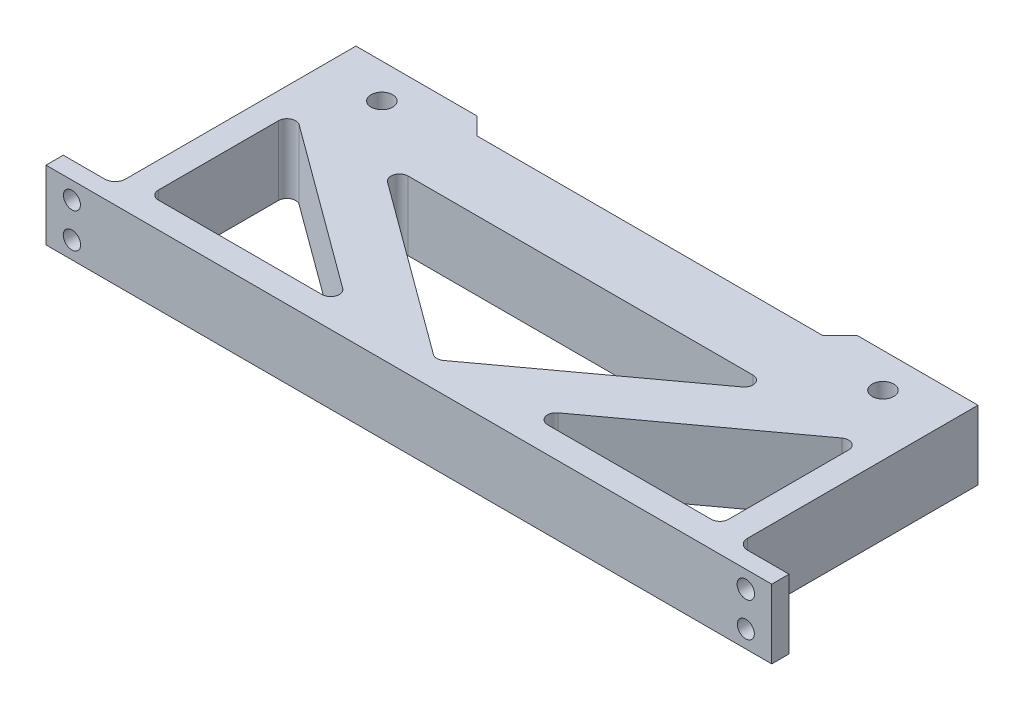
from build123d import *

# Parameters (mm, degrees)
SKETCH1_R           = 7.9375
BOSS_EXTRUDE1_DEPTH = 50.8
FILLET3_R           = 6.35
SKETCH2_W           = 82.55
SKETCH2_H           = 28.1432
CUT_EXTRUDE1_DEPTH  = 63.5
SKETCH3_W           = 38.1
SKETCH3_H           = 50.8
SKETCH3_R           = 6.235288689
SKETCH3_R_2         = 6.385077563
SKETCH3_R_3         = 6.411115974
SKETCH3_R_4         = 6.251946274
BOSS_EXTRUDE3_DEPTH = 12.7
FILLET4_R           = 7.62


with BuildPart() as part:
    # Sketch1 → Boss-Extrude1 (new body)
    with BuildSketch(Plane(origin=(0, 0, 0), x_dir=(1, 0, 0), z_dir=(0, 1, 0))):
        Polygon((-139.7, 94.8436), (-127, 82.1436), (127, 82.1436), (139.7, 94.8436), (228.6, 94.8436), (228.6, -94.8436), (-228.6, -94.8436), (-228.6, 94.8436), align=None)
        with Locations((-184.15, 69.4436)):
            Circle(SKETCH1_R, mode=Mode.SUBTRACT)
        with Locations((184.15, 69.4436)):
            Circle(SKETCH1_R, mode=Mode.SUBTRACT)
        Polygon((146.05, 31.3436), (-146.05, 31.3436), (0, -75.7936), align=None, mode=Mode.SUBTRACT)
        Polygon((-209.55, 31.3436), (-209.55, -75.7936), (-63.5, -75.7936), align=None, mode=Mode.SUBTRACT)
        Polygon((209.55, -75.7936), (63.5, -75.7936), (209.55, 31.3436), align=None, mode=Mode.SUBTRACT)
    extrude(amount=BOSS_EXTRUDE1_DEPTH)

    # Fillet3
    fillet3_edges = [part.edges().sort_by_distance(p)[0] for p in [
        (63.5, 25.4, 75.7936),
        (209.55, 25.4, -31.3436),
        (209.55, 25.4, 75.7936),
        (-63.5, 25.4, 75.7936),
        (-209.55, 25.4, -31.3436),
        (-209.55, 25.4, 75.7936),
        (146.05, 25.4, -31.3436),
        (0, 25.4, 75.7936),
        (-146.05, 25.4, -31.3436),
    ]]
    fillet(fillet3_edges, radius=FILLET3_R)

    # Sketch2 → Cut-Extrude1 (cut)
    with BuildSketch(Plane(origin=(0, 0, -94.8436), x_dir=(-1, 0, 0), z_dir=(0, 0, -1))):
        with Locations((184.15, 25.4)):
            Rectangle(SKETCH2_W, SKETCH2_H)
        with Locations((-184.15, 25.4)):
            Rectangle(SKETCH2_W, SKETCH2_H)
    extrude(amount=-CUT_EXTRUDE1_DEPTH, mode=Mode.SUBTRACT)

    # Sketch3 → Boss-Extrude3 (add)
    # profile 1 of 2: a face of its own
    with BuildSketch(Plane.XY.offset(94.8436)):
        with Locations((-247.65, 25.4)):
            Rectangle(SKETCH3_W, SKETCH3_H)
        with Locations((-247.65, 38.1)):
            Circle(SKETCH3_R, mode=Mode.SUBTRACT)
        with Locations((-247.65, 12.7)):
            Circle(SKETCH3_R_2, mode=Mode.SUBTRACT)
    # profile 2 of 2: a face of its own
    with BuildSketch(Plane.XY.offset(94.8436)):
        with Locations((247.65, 25.4)):
            Rectangle(SKETCH3_W, SKETCH3_H)
        with Locations((247.65, 38.1)):
            Circle(SKETCH3_R_3, mode=Mode.SUBTRACT)
        with Locations((247.65, 12.7)):
            Circle(SKETCH3_R_4, mode=Mode.SUBTRACT)
    extrude(amount=-BOSS_EXTRUDE3_DEPTH)

    # Fillet4
    fillet4_edges = [part.edges().sort_by_distance(p)[0] for p in [
        (228.6, 25.4, 82.1436),
        (-228.6, 25.4, 82.1436),
    ]]
    fillet(fillet4_edges, radius=FILLET4_R)


solid = part.part
